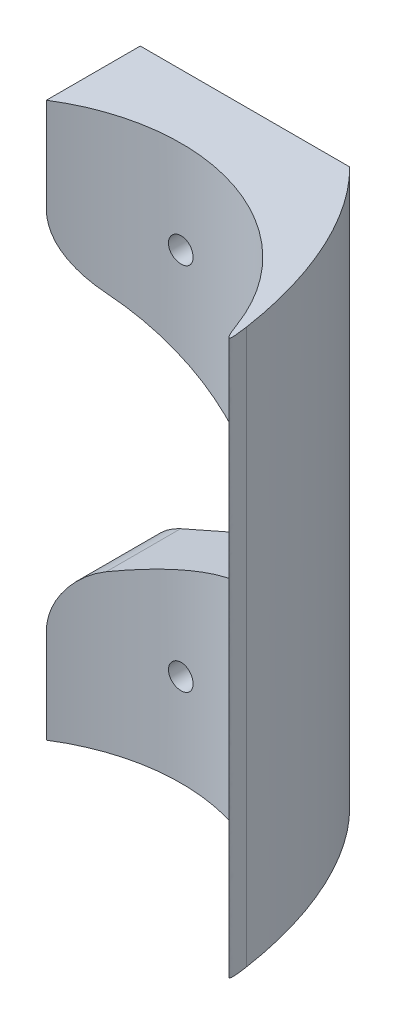
from build123d import *
from OCP.BRepAlgoAPI import BRepAlgoAPI_Cut
from OCP.TopTools import TopTools_ListOfShape

# Parameters (mm, degrees)
BOSS_EXTRUDE1_DEPTH = 45
FILLET1_START       = -1
FILLET1_DEPTH       = 47
SKETCH2_R           = 1.0000000000000002
SKETCH2_R_2         = 1
CUT_EXTRUDE2_DEPTH  = 30


with BuildPart() as part:
    # Sketch1 → Boss-Extrude1 (new body)
    with BuildSketch(Plane(origin=(0, 0, 0), x_dir=(1, 0, 0), z_dir=(0, 1, 0))):
        with BuildLine():
            add(Edge.make_bspline(
                [(-8.50000000000007, 21.18037767457174), (-15.999999999999995, 13.832083379312117), (-16, 5.08e-15)],
                knots=[0.5600753062265875, 0.5600753062265875, 0.5600753062265875, 1.5707963267948966, 1.5707963267948966, 1.5707963267948966], degree=2, weights=[1, 0.8750000000000013, 1]))
            ThreePointArc((-16, 1.96e-15), (9.8e-16, 16), (16, 0))
            add(Edge.make_bspline(
                [(16, -8.15e-15), (16.000000000000007, 13.83208337931212), (8.500000000000071, 21.18037767457174)],
                knots=[4.71238898038469, 4.71238898038469, 4.71238898038469, 5.723110000953, 5.723110000953, 5.723110000953], degree=2, weights=[1, 0.8750000000000011, 1]))
            Line((8.500000000000096, 21.18037767457181), (-8.500000000000096, 21.18037767457181))
        make_face()
    extrude(amount=BOSS_EXTRUDE1_DEPTH)


with BuildPart() as fillet1_tool:
    # Fillet1: read off the stored shape, not the designer's step
    # Fillet1 outline → Fillet1 (new body)
    with BuildSketch(Plane(origin=(0, 0, 0), x_dir=(1, 0, 0), z_dir=(0, 1, 0)).offset(FILLET1_START)):
        with BuildLine():
            ThreePointArc((-16, 0), (-15.747238962, 2.832748677), (-14.996941867, 5.575996291))
            add(Edge.make_bspline(
                [(-14.996941867, 5.575996291), (-16.0058043455114, 2.86260640488592), (-15.574790718, 5.72521281)],
                knots=[0, 0, 0, 1, 1, 1], degree=2))
            add(Edge.make_bspline(
                [(-15.574790718, 5.72521281), (-15.999999999999998, 2.901156361523757), (-16, 0)],
                knots=[1.3355704187750619, 1.3355704187750619, 1.3355704187750619, 1.5707963267948966, 1.5707963267948966, 1.5707963267948966], degree=2, weights=[0.9553582068029054, 0.9709086504543596, 1]))
        make_face()
        with BuildLine():
            add(Edge.make_bspline(
                [(15.574790718, 5.72521281), (16.0058043455114, 2.86260640488591), (14.996941867, 5.575996291)],
                knots=[0, 0, 0, 1, 1, 1], degree=2))
            ThreePointArc((14.996941867, 5.575996291), (15.747238962, 2.832748677), (16, 0))
            add(Edge.make_bspline(
                [(16, 0), (15.999999999999998, 2.901156361523736), (15.574790718, 5.72521281)],
                knots=[4.71238898038469, 4.71238898038469, 4.71238898038469, 4.947614888404523, 4.947614888404523, 4.947614888404523], degree=2, weights=[1, 0.9709086504543597, 0.9553582068029054]))
        make_face()
    extrude(amount=FILLET1_DEPTH)


with BuildPart() as part_1:
    add(part.part)

    # Fillet1: cut by fillet1_tool, with a tolerance
    fillet1_stock = TopTools_ListOfShape()
    fillet1_stock.Append(part_1.part.wrapped)
    fillet1_tools = TopTools_ListOfShape()
    fillet1_tools.Append(fillet1_tool.part.wrapped)
    fillet1_cut = BRepAlgoAPI_Cut()
    fillet1_cut.SetArguments(fillet1_stock)
    fillet1_cut.SetTools(fillet1_tools)
    fillet1_cut.SetFuzzyValue(0.00001)
    fillet1_cut.Build()
    add(Compound.cast(fillet1_cut.Shape()).solids(), mode=Mode.REPLACE)

    # Sketch2 → Cut-Extrude2 (cut)
    # profile 1 of 5: a face of its own
    with BuildSketch(Plane(origin=(0, 0, -21.18037767457181), x_dir=(-1, 0, 0), z_dir=(0, 0, -1))):
        Polygon((8.500000000000002, 45), (8.500000000000002, 37.334998409902454), (8.500000000000002, 7.665001590097545), (8.500000000000002, 0), (34.98658656522835, 0), (34.98658656522835, 45), align=None)
    # profile 2 of 5: a face of its own
    with BuildSketch(Plane(origin=(0, 0, -21.18037767457181), x_dir=(-1, 0, 0), z_dir=(0, 0, -1))):
        with BuildLine():
            Line((5.220021136169592, 32.302950501251296), (-5.2200211361696205, 27.697049498748697))
            ThreePointArc((-5.2200211361696205, 27.697049498748697), (-7.607608720851468, 25.668323396953035), (-8.500000000000005, 22.66500159009757))
            Line((-8.500000000000004, 22.66500159009757), (-8.500000000000004, 22.334998409902422))
            ThreePointArc((-8.500000000000005, 22.334998409902422), (-7.607608720851465, 19.331676603046958), (-5.220021136169617, 17.302950501251296))
            Line((-5.220021136169617, 17.302950501251296), (5.2200211361695885, 12.69704949874871))
            ThreePointArc((5.22002113616959, 12.697049498748711), (7.607608720851465, 10.668323396953037), (8.500000000000004, 7.665001590097545))
            Line((8.500000000000002, 7.665001590097545), (8.500000000000002, 37.334998409902454))
            ThreePointArc((8.499999999999998, 37.334998409902454), (7.607608720851465, 34.331676603046965), (5.220021136169594, 32.302950501251296))
        make_face()
        with Locations((0, 22.500000000000004)):
            Circle(SKETCH2_R, mode=Mode.SUBTRACT)
    # profile 3 of 5: a face of its own
    with BuildSketch(Plane(origin=(0, 0, -21.18037767457181), x_dir=(-1, 0, 0), z_dir=(0, 0, -1))):
        with Locations((0, 22.500000000000004)):
            Circle(SKETCH2_R)
    # profile 4 of 5: a face of its own
    with BuildSketch(Plane(origin=(0, 0, -21.18037767457181), x_dir=(-1, 0, 0), z_dir=(0, 0, -1))):
        with Locations((-1.388e-14, 37.5)):
            Circle(SKETCH2_R)
    # profile 5 of 5: a face of its own
    with BuildSketch(Plane(origin=(0, 0, -21.18037767457181), x_dir=(-1, 0, 0), z_dir=(0, 0, -1))):
        with Locations((-1.431e-14, 7.500000000000002)):
            Circle(SKETCH2_R_2)
    extrude(amount=-CUT_EXTRUDE2_DEPTH, mode=Mode.SUBTRACT)


solid = part_1.part
